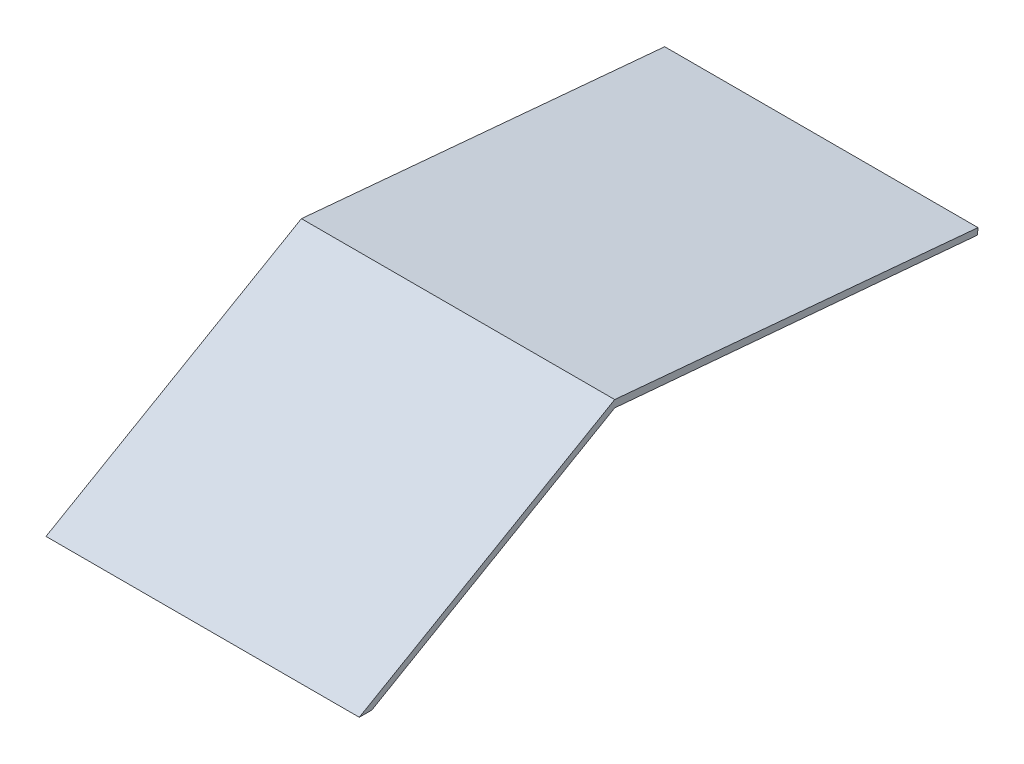
from build123d import *

# Parameters (mm, degrees)
BOSS_EXTRUDE1_DEPTH = 150


with BuildPart() as part:
    # Sketch1 → Boss-Extrude1 (new body)
    with BuildSketch(Plane(origin=(0, 0, 0), x_dir=(0, 0, -1), z_dir=(1, 0, 0))):
        Polygon((0, 0), (116.28989122, 67.14), (289.966474885, 51.945267809), (290.227942114, 54.933851904), (116.28989122, 70.604101615), (-6, 0), align=None)
    extrude(amount=BOSS_EXTRUDE1_DEPTH)


solid = part.part
